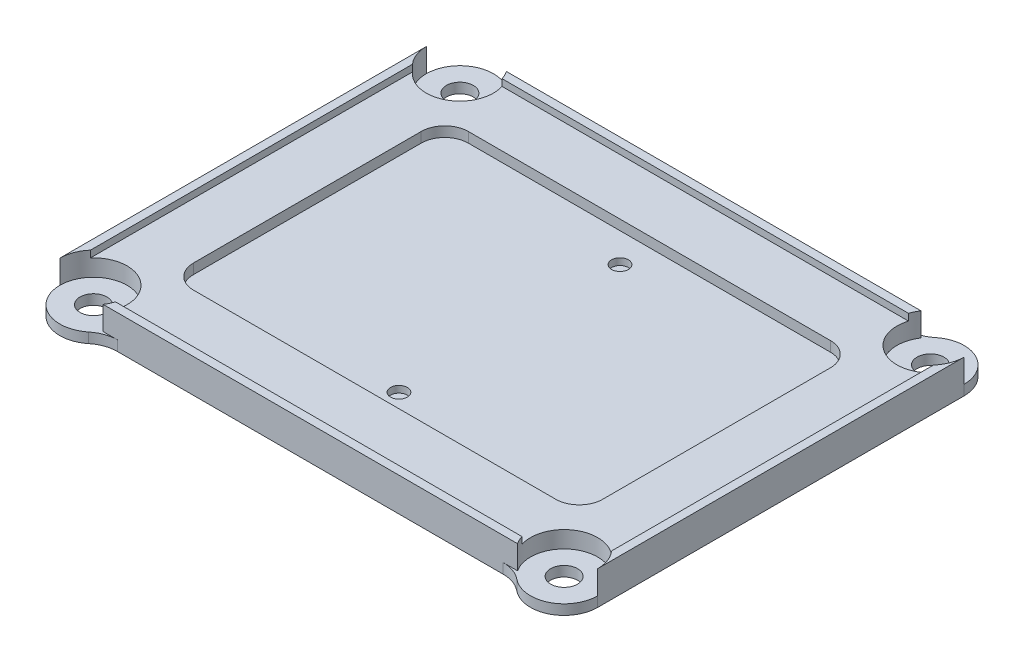
from build123d import *

# Parameters (mm, degrees)
SKETCH1_W               = 160
SKETCH1_H               = 129
BOSS_EXTRUDE1_DEPTH     = 8
SKETCH1_3_R             = 4
CUT_EXTRUDE2_DEPTH      = 104.074002542
FILLET1_R               = 10
CUT_EXTRUDE4_DEPTH      = 1
CUT_EXTRUDE4_DEPTH_BACK = 3
CUT_EXTRUDE4_START      = 8
CUT_EXTRUDE9_DEPTH      = 104.074002542
CUT_EXTRUDE10_START     = 8
SKETCH1_17_R            = 2.5
SKETCH1_17_R_2          = 10
CUT_EXTRUDE10_DEPTH     = 5
BOSS_EXTRUDE4_START     = 10
BOSS_EXTRUDE4_DEPTH     = 10
FILLET2_R               = 10


with BuildPart() as part:
    # Sketch1 → Boss-Extrude1 (new body)
    with BuildSketch(Plane(origin=(0, 0, 0), x_dir=(1, 0, 0), z_dir=(0, 1, 0))):
        Rectangle(SKETCH1_W, SKETCH1_H)
    extrude(amount=BOSS_EXTRUDE1_DEPTH)

    # Sketch1<3> → Cut-Extrude2 (cut, through all)
    with BuildSketch(Plane(origin=(0, 0, 0), x_dir=(1, 0, 0), z_dir=(0, 1, 0))):
        with Locations(Location((-70, 54.5, 0), (0, 0, 270))):
            Circle(SKETCH1_3_R)
        with Locations(Location((-70, -54.5, 0), (0, 0, 270))):
            Circle(SKETCH1_3_R)
        with Locations(Location((70, -54.5, 0), (0, 0, 90))):
            Circle(SKETCH1_3_R)
        with Locations(Location((70, 54.5, 0), (0, 0, 90))):
            Circle(SKETCH1_3_R)
    extrude(amount=CUT_EXTRUDE2_DEPTH, mode=Mode.SUBTRACT)

    # Fillet1
    fillet1_edges = [part.edges().sort_by_distance(p)[0] for p in [
        (80, 4, 64.5),
        (-80, 4, 64.5),
        (-80, 4, -64.5),
        (80, 4, -64.5),
    ]]
    fillet(fillet1_edges, radius=FILLET1_R)

    # Sketch1<11> → Cut-Extrude4 (cut, two sides: drawn at the far end of the back side and taken through both)
    with BuildSketch(Plane(origin=(0, 0, 0), x_dir=(1, 0, 0), z_dir=(0, 1, 0)).offset(CUT_EXTRUDE4_START - CUT_EXTRUDE4_DEPTH_BACK)):
        with BuildLine():
            Line((53.875, -40.875), (-53.875, -40.875))
            ThreePointArc((-53.875, -40.875), (-58.824747468, -38.824747468), (-60.875, -33.875))
            Line((-60.875, -33.875), (-60.875, 33.875))
            ThreePointArc((-60.875, 33.875), (-58.824747468, 38.824747468), (-53.875, 40.875))
            Line((-53.875, 40.875), (53.875, 40.875))
            ThreePointArc((53.875, 40.875), (58.824747468, 38.824747468), (60.875, 33.875))
            Line((60.875, 33.875), (60.875, -33.875))
            ThreePointArc((60.875, -33.875), (58.824747468, -38.824747468), (53.875, -40.875))
        make_face()
    extrude(amount=CUT_EXTRUDE4_DEPTH + CUT_EXTRUDE4_DEPTH_BACK, mode=Mode.SUBTRACT)

    # Sketch1<13> → Cut-Extrude9 (cut, through all)
    with BuildSketch(Plane(origin=(0, 0, 0), x_dir=(1, 0, 0), z_dir=(0, 1, 0))):
        with BuildLine():
            Line((-70, -64.5), (70, -64.5))
            ThreePointArc((70, -64.5), (65.25658351, -63.303408431), (61.648353456, -60))
            Line((61.648353456, -60), (-61.648353456, -60))
            ThreePointArc((-61.648353456, -60), (-65.25658351, -63.303408431), (-70, -64.5))
        make_face()
        with BuildLine():
            ThreePointArc((61.648353456, 60), (65.25658351, 63.303408431), (70, 64.5))
            Line((70, 64.5), (-69.999999984, 64.5))
            ThreePointArc((-69.999999984, 64.5), (-65.256583502, 63.303408427), (-61.648353456, 60))
            Line((-61.648353456, 60), (61.648353456, 60))
        make_face()
    extrude(amount=CUT_EXTRUDE9_DEPTH, mode=Mode.SUBTRACT)

    # Sketch1<17> → Cut-Extrude10 (cut)
    with BuildSketch(Plane(origin=(0, 0, 0), x_dir=(1, 0, 0), z_dir=(0, 1, 0)).offset(CUT_EXTRUDE10_START)):
        with Locations(Location((0, 32.125, 0), (0, 0, 270))):
            Circle(SKETCH1_17_R)
        with Locations((-70, 54.5)):
            Circle(SKETCH1_17_R_2)
        with Locations((70, 54.5)):
            Circle(SKETCH1_17_R_2)
        with Locations((-70, -54.5)):
            Circle(SKETCH1_17_R_2)
        with Locations((70, -54.5)):
            Circle(SKETCH1_17_R_2)
        with Locations(Location((0, -33.625, 0), (0, 0, 270))):
            Circle(SKETCH1_17_R)
    extrude(amount=-CUT_EXTRUDE10_DEPTH, mode=Mode.SUBTRACT)

    # Sketch1<18> → Boss-Extrude4 (add)
    with BuildSketch(Plane(origin=(0, 0, 0), x_dir=(1, 0, 0), z_dir=(0, 1, 0)).offset(BOSS_EXTRUDE4_START)):
        with BuildLine():
            ThreePointArc((60.460607986, 57.5), (60.967568701, 58.791291743), (61.648353456, 60))
            Line((61.648353456, 60), (-61.648353456, 60))
            ThreePointArc((-61.648353456, 60), (-60.967568701, 58.791291743), (-60.460607986, 57.5))
            Line((-60.460607986, 57.5), (60.460607986, 57.5))
        make_face()
        with BuildLine():
            Line((-80, 54.500000177), (-80, -54.5))
            ThreePointArc((-80, -54.5), (-79.354143467, -50.964466094), (-77.5, -47.885621722))
            Line((-77.5, -47.885621722), (-77.5, 47.885621722))
            ThreePointArc((-77.5, 47.885621722), (-79.354143498, 50.964466177), (-80, 54.500000177))
        make_face()
        with BuildLine():
            ThreePointArc((77.5, -47.885621722), (79.354143467, -50.964466094), (80, -54.5))
            Line((80, -54.5), (80, 54.5))
            ThreePointArc((80, 54.5), (79.354143467, 50.964466094), (77.5, 47.885621722))
            Line((77.5, 47.885621722), (77.5, -47.885621722))
        make_face()
        with BuildLine():
            Line((-61.648353456, -60), (61.648353456, -60))
            ThreePointArc((61.648353456, -60), (60.967568701, -58.791291743), (60.460607986, -57.5))
            Line((60.460607986, -57.5), (-60.460607986, -57.5))
            ThreePointArc((-60.460607986, -57.5), (-60.967568701, -58.791291743), (-61.648353456, -60))
        make_face()
    extrude(amount=-BOSS_EXTRUDE4_DEPTH)

    # Fillet2
    # the kernel refuses this fillet: 10 mm, written as the material it adds along each edge
    with BuildSketch(Plane(origin=(61.648353456, 0, 60), x_dir=(0.6702455950029323, 0, 0.7421393685684416), z_dir=(0, 1, 0)), Plane(origin=(-61.648353456, 0, -60), x_dir=(-0.6702455950029282, 0, -0.7421393685684453), z_dir=(0, 1, 0))) as fillet2_piece_1:
        with BuildLine():
            CenterArc((4.547663341, -9.884436465), FILLET2_R, 98.719009802, 39.194967426)
            Line((-2.873730345, -3.181980515), (0, 0))
            ThreePointArc((0, 0), (1.51588778, -0.115563535), (3.03177556, 0))
        make_face()
    extrude(amount=3)
    with BuildSketch(Plane(origin=(-61.648353456, 0, 60), x_dir=(1, 0, 0), z_dir=(0, 1, 0))) as fillet2_piece_2:
        with BuildLine():
            CenterArc((4.287578116, -10), FILLET2_R, 90, 39.194967426)
            ThreePointArc((-2.032034214, -2.25), (-0.930252859, -1.20245595), (0, 0))
            Line((0, 0), (4.287578116, 0))
        make_face()
    extrude(amount=3)
    with BuildSketch(Plane(origin=(61.648353456, 0, -60), x_dir=(0.6702455950029361, 0, -0.7421393685684381), z_dir=(0, 1, 0))) as fillet2_piece_3:
        with BuildLine():
            CenterArc((4.547663341, 9.884436465), FILLET2_R, 222.086022772, 39.194967426)
            Line((-2.873730345, 3.181980515), (0, 0))
            ThreePointArc((0, 0), (1.51588778, 0.115563535), (3.03177556, 0))
        make_face()
    extrude(amount=3)


solid = part.part
